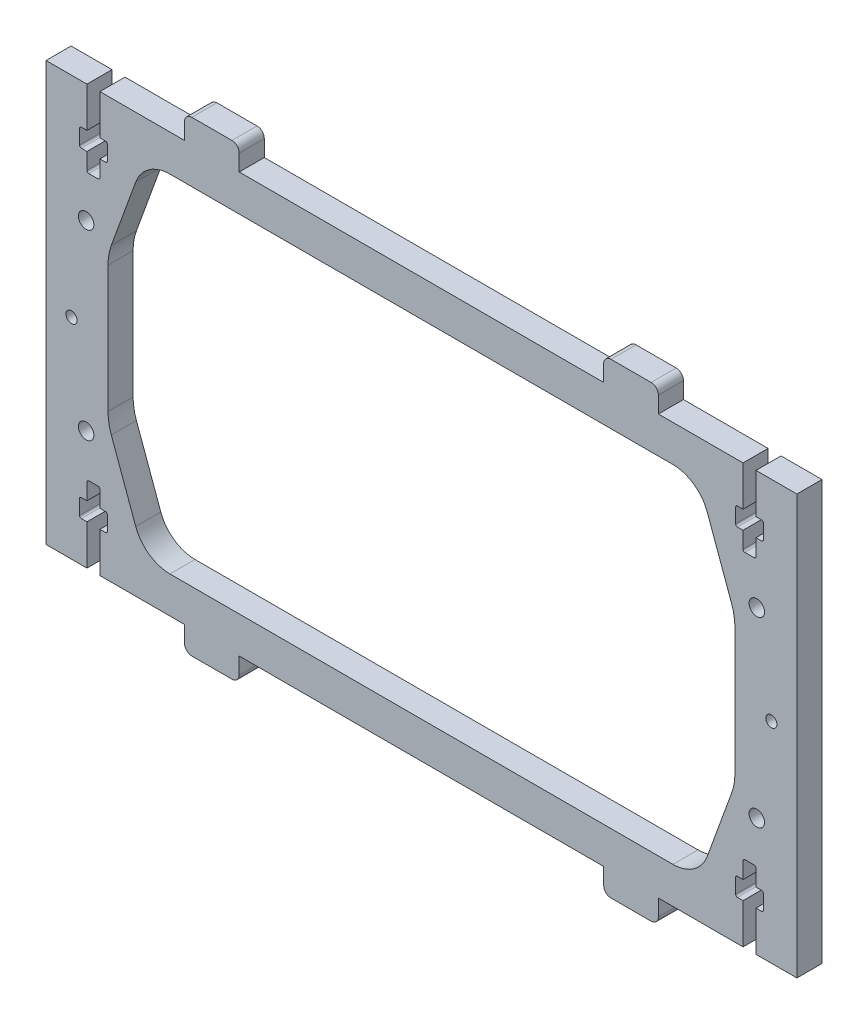
from build123d import *

# Parameters (mm, degrees)
SKETCH1_W            = 206
SKETCH1_H            = 115
BOSS_EXTRUDE1_DEPTH  = 6.88
SKETCH2_W            = 158
SKETCH2_H            = 95
CUT_EXTRUDE1_DEPTH   = 119.163380114
FILLET1_R            = 10
SKETCH3_W            = 3.55
SKETCH3_H            = 42
CUT_EXTRUDE2_DEPTH   = 119.163380114
SKETCH4_W            = 7.62
SKETCH4_H            = 5
CUT_EXTRUDE3_DEPTH   = 119.163380114
FILLET4_R            = 0.5
SKETCH5_W            = 15
SKETCH5_H            = 6.5
BOSS_EXTRUDE2_DEPTH  = 6.88
FILLET3_R            = 2
FILLET4_OF_MIRROR1_R = 0.5
FILLET3_OF_MIRROR1_R = 2
CUT_EXTRUDE4_START   = -6.88
CUT_EXTRUDE4_DEPTH   = 6.88
SKETCH7_R            = 2.125
SKETCH7_R_2          = 1.524
CUT_EXTRUDE5_DEPTH   = 122.459188207
MIRROR2_START        = -6.88
MIRROR2_OUTLINE_R    = 2.125
MIRROR2_OUTLINE_R_2  = 1.524
MIRROR2_DEPTH        = 6.88
MIRROR2_2_DEPTH      = 6.88
FILLET2_R            = 15


# Read off the part's stored shape, not the designer's step: Cut-Extrude4, Mirror2
with BuildPart() as part:
    # Sketch1 → Boss-Extrude1 (new body)
    with BuildSketch(Plane.XY):
        Rectangle(SKETCH1_W, SKETCH1_H)
    extrude(amount=-BOSS_EXTRUDE1_DEPTH)

    # Sketch2 → Cut-Extrude1 (cut, through all)
    with BuildSketch(Plane.XY):
        Rectangle(SKETCH2_W, SKETCH2_H)
    extrude(amount=-CUT_EXTRUDE1_DEPTH, mode=Mode.SUBTRACT)

    # Fillet1
    fillet1_edges = [part.edges().sort_by_distance(p)[0] for p in [
        (-79, -47.5, -3.44),
        (-79, 47.5, -3.44),
        (79, 47.5, -3.44),
        (79, -47.5, -3.44),
    ]]
    fillet(fillet1_edges, radius=FILLET1_R)

    # Sketch3 → Cut-Extrude2 (cut, through all)
    with BuildSketch(Plane.XY):
        with Locations((-90, 57.5)):
            Rectangle(SKETCH3_W, SKETCH3_H)
    cut_extrude2 = extrude(amount=-CUT_EXTRUDE2_DEPTH, mode=Mode.SUBTRACT)

    # Sketch4 → Cut-Extrude3 (cut, through all)
    with BuildSketch(Plane.XY):
        with Locations((-90, 44)):
            Rectangle(SKETCH4_W, SKETCH4_H)
    cut_extrude3 = extrude(amount=-CUT_EXTRUDE3_DEPTH, mode=Mode.SUBTRACT)

    # Fillet4
    fillet4_edges = [part.edges().sort_by_distance(p)[0] for p in [
        (-88.225, 36.5, -3.44),
        (-91.775, 36.5, -3.44),
        (-86.19, 41.5, -3.44),
        (-93.81, 46.5, -3.44),
        (-86.19, 46.5, -3.44),
        (-93.81, 41.5, -3.44),
    ]]
    fillet(fillet4_edges, radius=FILLET4_R)

    # Sketch5 → Boss-Extrude2 (add)
    with BuildSketch(Plane.XY):
        with Locations((-57.5, 60.75)):
            Rectangle(SKETCH5_W, SKETCH5_H)
    boss_extrude2 = extrude(amount=-BOSS_EXTRUDE2_DEPTH)

    # Fillet3
    fillet3_edges = [part.edges().sort_by_distance(p)[0] for p in [
        (-50, 64, -3.44),
        (-65, 64, -3.44),
    ]]
    fillet(fillet3_edges, radius=FILLET3_R)

    # Mirror1: Cut-Extrude2, Cut-Extrude3, Boss-Extrude2 across plane
    add(cut_extrude2.mirror(Plane.ZX), mode=Mode.SUBTRACT)
    add(cut_extrude3.mirror(Plane.ZX), mode=Mode.SUBTRACT)
    add(boss_extrude2.mirror(Plane.ZX))

    # Fillet4 of Mirror1
    fillet4_of_mirror1_edges = [part.edges().sort_by_distance(p)[0] for p in [
        (-88.225, -36.5, -3.44),
        (-91.775, -36.5, -3.44),
        (-86.19, -41.5, -3.44),
        (-93.81, -46.5, -3.44),
        (-86.19, -46.5, -3.44),
        (-93.81, -41.5, -3.44),
    ]]
    fillet(fillet4_of_mirror1_edges, radius=FILLET4_OF_MIRROR1_R)

    # Fillet3 of Mirror1
    fillet3_of_mirror1_edges = [part.edges().sort_by_distance(p)[0] for p in [
        (-50, -64, -3.44),
        (-65, -64, -3.44),
    ]]
    fillet(fillet3_of_mirror1_edges, radius=FILLET3_OF_MIRROR1_R)

    # Cut-Extrude4 outline → Cut-Extrude4 (cut)
    with BuildSketch(Plane.XY.offset(CUT_EXTRUDE4_START)):
        with BuildLine():
            Line((-78.396926208, 40.920201433), (-86, 20.030927871))
            Line((-86, 20.030927871), (-86, -20.030927871))
            Line((-86, -20.030927871), (-78.396926208, -40.920201433))
            ThreePointArc((-78.396926208, -40.920201433), (-78.84807753, -39.236481777), (-79, -37.5))
            Line((-79, -37.5), (-79, 37.5))
            ThreePointArc((-79, 37.5), (-78.84807753, 39.236481777), (-78.396926208, 40.920201433))
        make_face()
    extrude(amount=CUT_EXTRUDE4_DEPTH, mode=Mode.SUBTRACT)

    # Sketch7 → Cut-Extrude5 (cut, through all)
    with BuildSketch(Plane.XY):
        with Locations((-92, 25)):
            Circle(SKETCH7_R)
        with Locations((-92, -25)):
            Circle(SKETCH7_R)
        with Locations((-96, 0)):
            Circle(SKETCH7_R_2)
    extrude(amount=-CUT_EXTRUDE5_DEPTH, mode=Mode.SUBTRACT)

    # Mirror2 outline → Mirror2 (cut)
    with BuildSketch(Plane.XY.offset(MIRROR2_START)):
        with BuildLine():
            Line((88.225, 57.5), (88.225, 46.5))
            Line((88.225, 46.5), (86.69, 46.5))
            ThreePointArc((86.69, 46.5), (86.336446609, 46.353553391), (86.19, 46))
            Line((86.19, 46), (86.19, 42))
            ThreePointArc((86.19, 42), (86.336446609, 41.646446609), (86.69, 41.5))
            Line((86.69, 41.5), (88.225, 41.5))
            Line((88.225, 41.5), (88.225, 37))
            ThreePointArc((88.225, 37), (88.371446609, 36.646446609), (88.725, 36.5))
            Line((88.725, 36.5), (91.275, 36.5))
            ThreePointArc((91.275, 36.5), (91.628553391, 36.646446609), (91.775, 37))
            Line((91.775, 37), (91.775, 41.5))
            Line((91.775, 41.5), (93.31, 41.5))
            ThreePointArc((93.31, 41.5), (93.663553391, 41.646446609), (93.81, 42))
            Line((93.81, 42), (93.81, 46))
            ThreePointArc((93.81, 46), (93.663553391, 46.353553391), (93.31, 46.5))
            Line((93.31, 46.5), (91.775, 46.5))
            Line((91.775, 46.5), (91.775, 57.5))
            Line((91.775, 57.5), (88.225, 57.5))
        make_face()
        with BuildLine():
            ThreePointArc((88.725, -36.5), (88.371446609, -36.646446609), (88.225, -37))
            Line((88.225, -37), (88.225, -41.5))
            Line((88.225, -41.5), (86.69, -41.5))
            ThreePointArc((86.69, -41.5), (86.336446609, -41.646446609), (86.19, -42))
            Line((86.19, -42), (86.19, -46))
            ThreePointArc((86.19, -46), (86.336446609, -46.353553391), (86.69, -46.5))
            Line((86.69, -46.5), (88.225, -46.5))
            Line((88.225, -46.5), (88.225, -57.5))
            Line((88.225, -57.5), (91.775, -57.5))
            Line((91.775, -57.5), (91.775, -46.5))
            Line((91.775, -46.5), (93.31, -46.5))
            ThreePointArc((93.31, -46.5), (93.663553391, -46.353553391), (93.81, -46))
            Line((93.81, -46), (93.81, -42))
            ThreePointArc((93.81, -42), (93.663553391, -41.646446609), (93.31, -41.5))
            Line((93.31, -41.5), (91.775, -41.5))
            Line((91.775, -41.5), (91.775, -37))
            ThreePointArc((91.775, -37), (91.628553391, -36.646446609), (91.275, -36.5))
            Line((91.275, -36.5), (88.725, -36.5))
        make_face()
        with BuildLine():
            Line((86, -20.030927871), (86, 20.030927871))
            Line((86, 20.030927871), (78.396926208, 40.920201433))
            ThreePointArc((78.396926208, 40.920201433), (78.84807753, 39.236481777), (79, 37.5))
            Line((79, 37.5), (79, -37.5))
            ThreePointArc((79, -37.5), (78.84807753, -39.236481777), (78.396926208, -40.920201433))
            Line((78.396926208, -40.920201433), (86, -20.030927871))
        make_face()
        with Locations((92, 25)):
            Circle(MIRROR2_OUTLINE_R)
        with Locations((92, -25)):
            Circle(MIRROR2_OUTLINE_R)
        with Locations((96, 0)):
            Circle(MIRROR2_OUTLINE_R_2)
    extrude(amount=MIRROR2_DEPTH, mode=Mode.SUBTRACT)

    # Mirror2 2 outline → Mirror2 2 (add)
    with BuildSketch(Plane.XY.offset(MIRROR2_START)):
        with BuildLine():
            Line((50, 57.5), (65, 57.5))
            Line((65, 57.5), (65, 62))
            ThreePointArc((65, 62), (64.414213562, 63.414213562), (63, 64))
            Line((63, 64), (52, 64))
            ThreePointArc((52, 64), (50.585786438, 63.414213562), (50, 62))
            Line((50, 62), (50, 57.5))
        make_face()
        with BuildLine():
            Line((65, -62), (65, -57.5))
            Line((65, -57.5), (50, -57.5))
            Line((50, -57.5), (50, -62))
            ThreePointArc((50, -62), (50.585786438, -63.414213562), (52, -64))
            Line((52, -64), (63, -64))
            ThreePointArc((63, -64), (64.414213562, -63.414213562), (65, -62))
        make_face()
    extrude(amount=MIRROR2_2_DEPTH)

    # Fillet2
    fillet2_edges = [part.edges().sort_by_distance(p)[0] for p in [
        (-86, -20.030927871, -3.44),
        (-86, 20.030927871, -3.44),
        (86, 20.030927871, -3.44),
        (86, -20.030927871, -3.44),
    ]]
    fillet(fillet2_edges, radius=FILLET2_R)


solid = part.part
